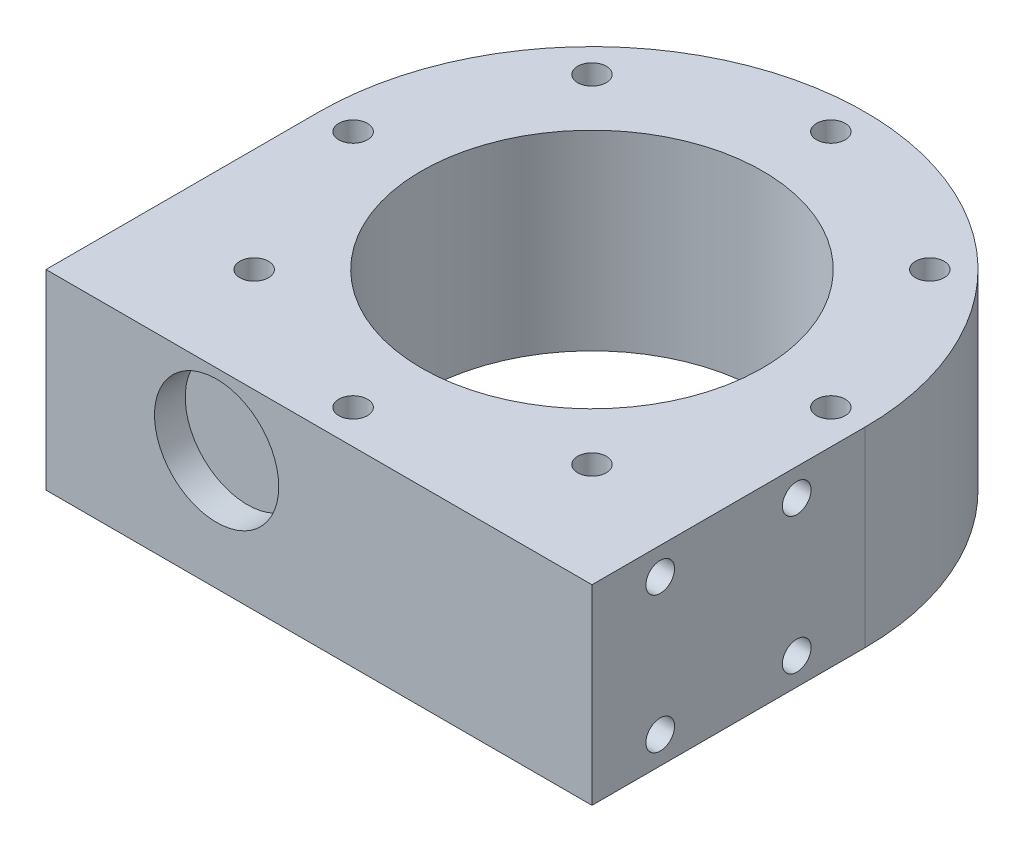
from build123d import *

# Parameters (mm, degrees)
SKETCH_1_R          = 25
EXTRUDE_1_DEPTH     = 28
SKETCH_2_R          = 2.1
CUT_EXTRUDE_1_DEPTH = 64.118935352
SKETCH_6_R          = 9.1
CUT_EXTRUDE_2_DEPTH = 4.5
SKETCH_7_R          = 2.1
CUT_EXTRUDE_3_DEPTH = 4


with BuildPart() as part:
    # 草图1 → 凸台-拉伸1 (new body)
    with BuildSketch(Plane(origin=(0, 0, 0), x_dir=(1, 0, 0), z_dir=(0, 1, 0))):
        with BuildLine():
            Line((-40, 0), (-40, -40))
            Line((-40, -40), (40, -40))
            Line((40, -40), (40, 0))
            ThreePointArc((40, 0), (0, 40), (-40, 0))
        make_face()
        Circle(SKETCH_1_R, mode=Mode.SUBTRACT)
    extrude(amount=EXTRUDE_1_DEPTH)

    # 草图2 → 切除-拉伸1 (cut, through all)
    with BuildSketch(Plane(origin=(0, 28, 0), x_dir=(1, 0, 0), z_dir=(0, 1, 0))):
        with Locations((0, 35)):
            Circle(SKETCH_2_R)
        with Locations((24.748737342, 24.748737342)):
            Circle(SKETCH_2_R)
        with Locations((35, 0)):
            Circle(SKETCH_2_R)
        with Locations((24.748737342, -24.748737342)):
            Circle(SKETCH_2_R)
        with Locations((0, -35)):
            Circle(SKETCH_2_R)
        with Locations((-24.748737342, -24.748737342)):
            Circle(SKETCH_2_R)
        with Locations((-35, 0)):
            Circle(SKETCH_2_R)
        with Locations((-24.748737342, 24.748737342)):
            Circle(SKETCH_2_R)
    extrude(amount=-CUT_EXTRUDE_1_DEPTH, mode=Mode.SUBTRACT)

    # 草图6 → 切除-拉伸2 (cut)
    with BuildSketch(Plane.XY.offset(40)):
        with Locations((-15, 17.5)):
            Circle(SKETCH_6_R)
    extrude(amount=-CUT_EXTRUDE_2_DEPTH, mode=Mode.SUBTRACT)

    # 草图7 → 切除-拉伸3 (cut)
    with BuildSketch(Plane.ZY.offset(40)):
        with Locations((10, 24)):
            Circle(SKETCH_7_R)
        with Locations((30, 24)):
            Circle(SKETCH_7_R)
        with Locations((10, 4)):
            Circle(SKETCH_7_R)
        with Locations((30, 4)):
            Circle(SKETCH_7_R)
    cut_extrude_3 = extrude(amount=-CUT_EXTRUDE_3_DEPTH, mode=Mode.SUBTRACT)

    # 镜向1: 切除-拉伸3 across plane
    add(cut_extrude_3.mirror(Plane.ZY), mode=Mode.SUBTRACT)


solid = part.part
